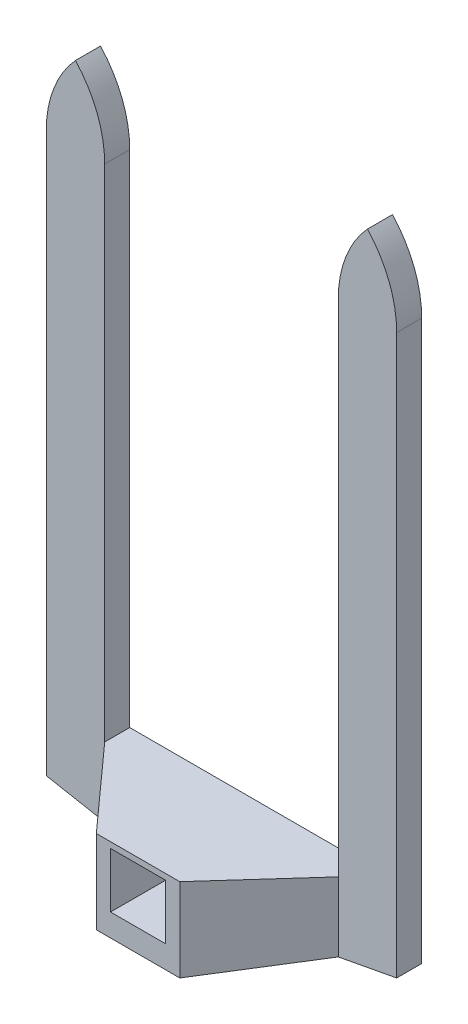
from build123d import *

# Parameters (mm, degrees)
SALIENTE_EXTRUIR1_DEPTH             = 3
CROQUIS2_W                          = 10
CROQUIS2_H                          = 10
SALIENTE_EXTRUIR2_DEPTH             = 10
CROQUIS3_W                          = 6.2
CROQUIS3_H                          = 6.2
CORTAR_EXTRUIR1_DEPTH               = 349.280563017
NGULO_START                         = 278.403728499
NGULO_DE_SALIDA1_DEPTH              = 10
NGULO_START_2                       = 46.606431878
NGULO_DE_SALIDA1_2_DEPTH            = 11.393568122
DI_METRO_DE_TALADRO_3_8_3_8_1_D     = 3.8
DI_METRO_DE_TALADRO_3_8_3_8_1_DEPTH = 2.9
REDONDEO1_R                         = 0.4
CROQUIS7_W                          = 7
CROQUIS7_H                          = 10
SALIENTE_EXTRUIR3_DEPTH             = 3
CROQUIS8_W                          = 6.6
CROQUIS8_H                          = 6.6
CORTAR_EXTRUIR2_DEPTH               = 359.256088776


with BuildPart() as part:
    # Croquis1 → Saliente-Extruir1 (new body)
    with BuildSketch(Plane(origin=(0, 0, 43.606431878), x_dir=(-1, 0, 0), z_dir=(0, 0, -1))):
        with BuildLine():
            Line((-21, 338.403728499), (-21, 281.403728499))
            Line((-21, 281.403728499), (-5, 278.403728499))
            Line((-5, 278.403728499), (5, 278.403728499))
            Line((5, 278.403728499), (21, 281.403728499))
            Line((21, 281.403728499), (21, 338.403728499))
            ThreePointArc((21, 338.403728499), (20.094205089, 343.232030478), (17.5, 347.403728499))
            ThreePointArc((17.5, 347.403728499), (14.905794911, 343.232030478), (14, 338.403728499))
            Line((14, 338.403728499), (14, 288.403728499))
            Line((14, 288.403728499), (-14, 288.403728499))
            Line((-14, 288.403728499), (-14, 338.403728499))
            ThreePointArc((-14, 338.403728499), (-14.905794911, 343.232030478), (-17.5, 347.403728499))
            ThreePointArc((-17.5, 347.403728499), (-20.094205089, 343.232030478), (-21, 338.403728499))
        make_face()
    extrude(amount=-SALIENTE_EXTRUIR1_DEPTH)

    # Croquis2 → Saliente-Extruir2 (add)
    with BuildSketch(Plane.XY.offset(46.606431878)):
        with Locations((0, 283.403728499)):
            Rectangle(CROQUIS2_W, CROQUIS2_H)
    extrude(amount=SALIENTE_EXTRUIR2_DEPTH)

    # Croquis3 → Cortar-Extruir1 (cut, through all)
    with BuildSketch(Plane.XY.offset(56.606431878)):
        with Locations((0, 284.403728499)):
            Rectangle(CROQUIS3_W, CROQUIS3_H)
    extrude(amount=-CORTAR_EXTRUIR1_DEPTH, mode=Mode.SUBTRACT)

    # Ángulo de salida1: read off the stored shape, not the designer's step
    # Ángulo de salida1 outline → Ángulo de salida1 (add)
    with BuildSketch(Plane(origin=(0, 0, 0), x_dir=(1, 0, 0), z_dir=(0, 1, 0)).offset(NGULO_START)):
        Polygon((-5, -46.606431878), (-14, -46.606431878), (-5, -56.606431878), align=None)
        Polygon((5, -46.606431878), (5, -56.606431878), (14, -46.606431878), align=None)
    extrude(amount=NGULO_DE_SALIDA1_DEPTH)

    # ngulo de salida1 2 outline → ngulo de salida1 2 (cut)
    with BuildSketch(Plane.XY.offset(NGULO_START_2)):
        Polygon((-5, 278.403728499), (-16, 280.466228499), (-16, 278.403728499), align=None)
        Polygon((15, 280.278728499), (5, 278.403728499), (15, 278.403728499), align=None)
    extrude(amount=NGULO_DE_SALIDA1_2_DEPTH, mode=Mode.SUBTRACT)

    # Diámetro de taladro Ø3.8 (3.8)1
    with Locations(Plane(origin=(0, 281.303728499, 0), x_dir=(1, 0, 0), z_dir=(0, 1, 0))):
        with Locations((0, -50.106431878)):
            Hole(DI_METRO_DE_TALADRO_3_8_3_8_1_D / 2, depth=DI_METRO_DE_TALADRO_3_8_3_8_1_DEPTH)

    # Redondeo1
    redondeo1_edges = [part.edges().sort_by_distance(p)[0] for p in [
        (-17.5, 347.403728499, 45.106431878),
        (17.5, 347.403728499, 45.106431878),
    ]]
    fillet(redondeo1_edges, radius=REDONDEO1_R)

    # Croquis7 → Saliente-Extruir3 (add, through all)
    with BuildSketch(Plane.XY.offset(46.606431878)):
        with BuildLine():
            Line((-14, 338.403728499), (-14, 348.403728499))
            Line((-14, 348.403728499), (-21, 348.403728499))
            Line((-21, 348.403728499), (-21, 338.403728499))
            ThreePointArc((-21, 338.403728499), (-20.175493128, 343.017556325), (-17.804035379, 347.060254302))
            ThreePointArc((-17.804035379, 347.060254302), (-17.5, 347.20032645), (-17.195964621, 347.060254302))
            ThreePointArc((-17.195964621, 347.060254302), (-14.824506872, 343.017556325), (-14, 338.403728499))
        make_face()
        with BuildLine():
            ThreePointArc((-14, 348.403728499), (-14.905794911, 353.232030478), (-17.5, 357.403728499))
            ThreePointArc((-17.5, 357.403728499), (-20.094205089, 353.232030478), (-21, 348.403728499))
            Line((-21, 348.403728499), (-14, 348.403728499))
        make_face()
        with BuildLine():
            ThreePointArc((14, 348.403728499), (14.905794911, 353.232030478), (17.5, 357.403728499))
            ThreePointArc((17.5, 357.403728499), (20.094205089, 353.232030478), (21, 348.403728499))
            Line((21, 348.403728499), (14, 348.403728499))
        make_face()
        with Locations((17.5, 343.403728499)):
            Rectangle(CROQUIS7_W, CROQUIS7_H)
    extrude(amount=-SALIENTE_EXTRUIR3_DEPTH)

    # Croquis8 → Cortar-Extruir2 (cut, through all)
    with BuildSketch(Plane.XY.offset(56.606431878)):
        with Locations((0, 284.403728499)):
            Rectangle(CROQUIS8_W, CROQUIS8_H)
    extrude(amount=-CORTAR_EXTRUIR2_DEPTH, mode=Mode.SUBTRACT)


solid = part.part
